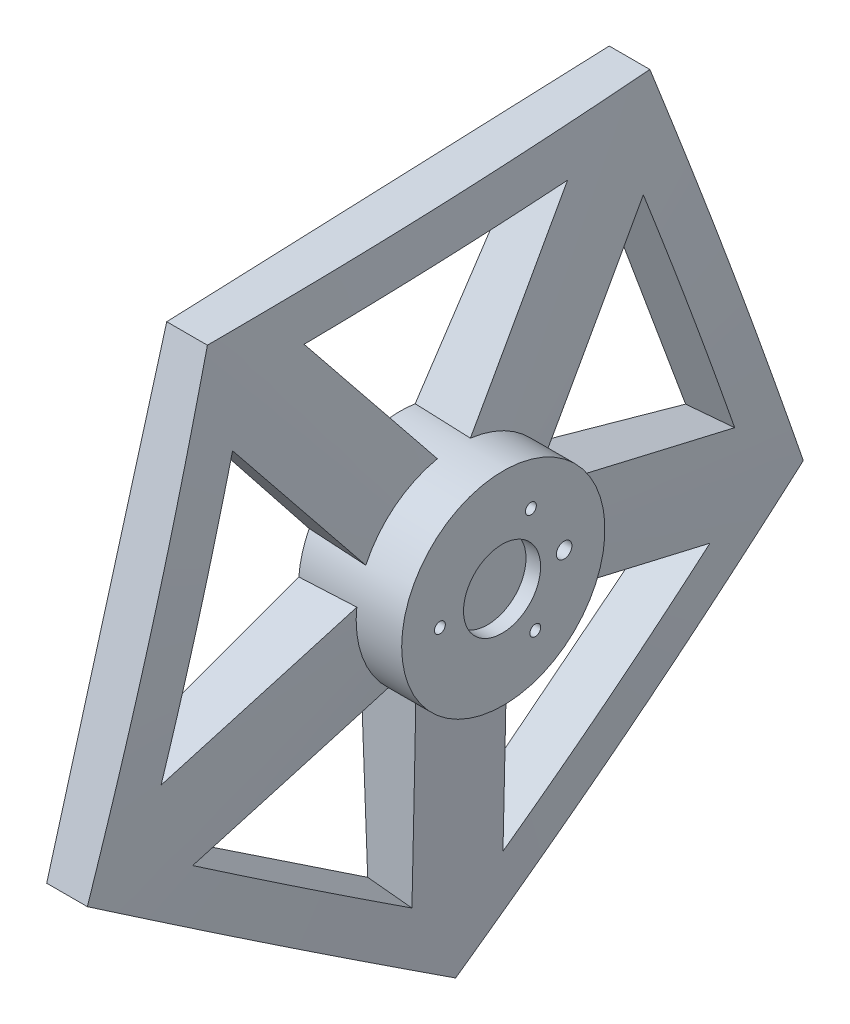
from build123d import *
from OCP.BRepAlgoAPI import BRepAlgoAPI_Cut
from OCP.TopTools import TopTools_ListOfShape
from build123d.topology import SkipClean

# Parameters (mm, degrees)
EXTRUDE_1_DEPTH             = 24
CUT_EXTRUDE_1_DEPTH         = 30
PATTERN_CIRCULAR_1_COUNT    = 5
CUT_EXTRUDE_2_DEPTH         = 84
PATTERN_CIRCULAR_2_COUNT    = 5
SKETCH_3_R                  = 33.35
EXTRUDE_2_DEPTH             = 60
CUT_EXTRUDE_START           = 0.102
CUT_EXTRUDE_4_OUTLINE_R     = 33.35
CUT_EXTRUDE_4_OUTLINE_R_2   = 9.18
CUT_EXTRUDE_4_DEPTH         = 5.799227236
CUT_EXTRUDE_START_2         = -12.5
CUT_EXTRUDE_4_2_OUTLINE_R   = 1.683
CUT_EXTRUDE_4_2_OUTLINE_R_2 = 2.448
CUT_EXTRUDE_4_2_DEPTH       = 12.738427236
CUT_EXTRUDE_START_3         = -1.428
CUT_EXTRUDE_4_3_OUTLINE_R   = 10.914
CUT_EXTRUDE_4_3_OUTLINE_R_2 = 9.18
CUT_EXTRUDE_4_3_DEPTH       = 1.666427236
CUT_EXTRUDE_4_4_OUTLINE_R   = 11.22
CUT_EXTRUDE_4_4_OUTLINE_R_2 = 10.914
CUT_EXTRUDE_4_4_DEPTH       = 1.122
CUT_EXTRUDE_4_5_OUTLINE_R   = 11.22
CUT_EXTRUDE_4_5_OUTLINE_R_2 = 10.914
CUT_EXTRUDE_4_5_DEPTH       = 0.238427236
SKETCH_11_R                 = 12.642
SKETCH_11_R_2               = 1.783
SKETCH_11_R_3               = 2.548
CUT_EXTRUDE_7_DEPTH         = 25
CUT_EXTRUDE_8_DEPTH         = 182.687484155
CUT_EXTRUDE_8_DEPTH_BACK    = 182.687484155
SKETCH_12_W                 = 55.167462985
SKETCH_12_H                 = 93.873666854
CUT_EXTRUDE_9_DEPTH         = 175.808256688
CUT_EXTRUDE_9_DEPTH_BACK    = 175.808256688
SKETCH_13_R                 = 1.783
SKETCH_13_R_2               = 2.548
SKETCH_14_R                 = 4.783
SKETCH_14_R_2               = 5.548
CUT_EXTRUDE_10_DEPTH        = 15


with BuildPart() as part:
    # 草图1 → 凸台-拉伸1 (new body)
    with BuildSketch(Plane(origin=(0, 0, 0), x_dir=(0, 0, -1), z_dir=(1, 0, 0))):
        Polygon((118.97758907, -33.510800483), (68.636762138, 102.799004534), (-76.557737191, 97.044079295), (-115.952045824, -42.822465123), (4.895431807, -123.509818223), align=None)
    extrude(amount=EXTRUDE_1_DEPTH)

    # 草图2 → 切除-拉伸1 (cut)
    with BuildSketch(Plane(origin=(21.885665564, 0.414902387, 1.473079874), x_dir=(0, 0.9625489150768215, -0.2711080708581613), z_dir=(-0.9975640502598243, -0.018911543026637837, -0.06714401812199275))):
        Polygon((-72.654252801, -98.71005792), (72.654252801, -98.71005792), (368.193435696, -98.71005792), (343.034484831, 55.492595796), (-381.628768987, 22.909231101), (-450.567959047, -98.71005792), align=None)
    cut_extrude_1 = extrude(amount=-CUT_EXTRUDE_1_DEPTH, mode=Mode.SUBTRACT)

    # 阵列(圆周)1: 切除-拉伸1 ×5 about axis
    pattern_circular_1_axis = Axis((0, 0, 0), (1, 0, 0))
    for i in range(1, PATTERN_CIRCULAR_1_COUNT):
        add(cut_extrude_1.rotate(pattern_circular_1_axis, i * 360 / PATTERN_CIRCULAR_1_COUNT), mode=Mode.SUBTRACT)

    # 草图4 → 切除-拉伸2 (cut)
    with BuildSketch(Plane(origin=(21.885665564, 0.530191543, -1.435620156), x_dir=(-0.06540654102068788, -0.0020321134284714422, -0.9978566304368194), z_dir=(0.9975640502598243, 0.024166503933362515, -0.06543657782046403))):
        Polygon((93.526415419, -11.461750602), (63.453576352, 69.657775992), (22.527950254, 8.351619529), align=None)
    cut_extrude_2 = extrude(amount=-CUT_EXTRUDE_2_DEPTH, mode=Mode.SUBTRACT)

    # 阵列(圆周)2: 切除-拉伸2 ×5 about axis
    pattern_circular_2_axis = Axis((0, 0, 0), (1, 0, 0))
    for i in range(1, PATTERN_CIRCULAR_2_COUNT):
        add(cut_extrude_2.rotate(pattern_circular_2_axis, i * 360 / PATTERN_CIRCULAR_2_COUNT), mode=Mode.SUBTRACT)

    # 草图3 → 凸台-拉伸2 (add)
    with BuildSketch(Plane.ZY):
        Circle(SKETCH_3_R)
    extrude(amount=-EXTRUDE_2_DEPTH)


with BuildPart() as cut_extrude_4_tool:
    # 切除-拉伸4: read off the stored shape, not the designer's step
    # 切除-拉伸4 outline → 切除-拉伸4 (new body)
    with BuildSketch(Plane(origin=(54.098772764, 0, 0), x_dir=(0, 0, -1), z_dir=(1, 0, 0)).offset(CUT_EXTRUDE_START)):
        Circle(CUT_EXTRUDE_4_OUTLINE_R)
        with Locations((-0.4144, 0.002184363)):
            Circle(CUT_EXTRUDE_4_OUTLINE_R_2, mode=Mode.SUBTRACT)
    extrude(amount=CUT_EXTRUDE_4_DEPTH)


with BuildPart() as part_1:
    add(part.part)

    # 切除-拉伸4: cut by cut_extrude_4_tool, with a tolerance
    cut_extrude_4_stock = TopTools_ListOfShape()
    cut_extrude_4_stock.Append(part_1.part.wrapped)
    cut_extrude_4_tools = TopTools_ListOfShape()
    cut_extrude_4_tools.Append(cut_extrude_4_tool.part.wrapped)
    cut_extrude_4_cut = BRepAlgoAPI_Cut()
    cut_extrude_4_cut.SetArguments(cut_extrude_4_stock)
    cut_extrude_4_cut.SetTools(cut_extrude_4_tools)
    cut_extrude_4_cut.SetFuzzyValue(0.00001)
    cut_extrude_4_cut.Build()
    add(Compound.cast(cut_extrude_4_cut.Shape()).solids(), mode=Mode.REPLACE)


with BuildPart() as cut_extrude_4_2_tool:
    # Cut-Extrude 4 2 outline → Cut-Extrude 4 2 (new body)
    with BuildSketch(Plane(origin=(54.098772764, 0, 0), x_dir=(0, 0, -1), z_dir=(1, 0, 0)).offset(CUT_EXTRUDE_START_2)):
        with Locations((-20.797458989, -0.829023312)):
            Circle(CUT_EXTRUDE_4_2_OUTLINE_R)
        with Locations((9.057282532, 18.070035094)):
            Circle(CUT_EXTRUDE_4_2_OUTLINE_R)
        with Locations((19.96865899, 0.83339204)):
            Circle(CUT_EXTRUDE_4_2_OUTLINE_R_2)
        with Locations((10.496976459, -17.234458691)):
            Circle(CUT_EXTRUDE_4_2_OUTLINE_R)
    extrude(amount=CUT_EXTRUDE_4_2_DEPTH)


with BuildPart() as part_2:
    add(part_1.part)

    # Cut-Extrude 4 2: cut by cut_extrude_4_2_tool, with a tolerance
    cut_extrude_4_2_stock = TopTools_ListOfShape()
    cut_extrude_4_2_stock.Append(part_2.part.wrapped)
    cut_extrude_4_2_tools = TopTools_ListOfShape()
    cut_extrude_4_2_tools.Append(cut_extrude_4_2_tool.part.wrapped)
    cut_extrude_4_2_cut = BRepAlgoAPI_Cut()
    cut_extrude_4_2_cut.SetArguments(cut_extrude_4_2_stock)
    cut_extrude_4_2_cut.SetTools(cut_extrude_4_2_tools)
    cut_extrude_4_2_cut.SetFuzzyValue(0.00001)
    cut_extrude_4_2_cut.Build()
    add(Compound.cast(cut_extrude_4_2_cut.Shape()).solids(), mode=Mode.REPLACE)


with BuildPart() as cut_extrude_4_3_tool:
    # Cut-Extrude 4 3 outline → Cut-Extrude 4 3 (new body)
    with BuildSketch(Plane(origin=(54.098772764, 0, 0), x_dir=(0, 0, -1), z_dir=(1, 0, 0)).offset(CUT_EXTRUDE_START_3)):
        with Locations((-0.4144, 0.002184363)):
            Circle(CUT_EXTRUDE_4_3_OUTLINE_R)
        with Locations((-0.4144, 0.002184363)):
            Circle(CUT_EXTRUDE_4_3_OUTLINE_R_2, mode=Mode.SUBTRACT)
    extrude(amount=CUT_EXTRUDE_4_3_DEPTH)


with BuildPart() as part_3:
    add(part_2.part)

    # Cut-Extrude 4 3: cut by cut_extrude_4_3_tool, with a tolerance
    cut_extrude_4_3_stock = TopTools_ListOfShape()
    cut_extrude_4_3_stock.Append(part_3.part.wrapped)
    cut_extrude_4_3_tools = TopTools_ListOfShape()
    cut_extrude_4_3_tools.Append(cut_extrude_4_3_tool.part.wrapped)
    cut_extrude_4_3_cut = BRepAlgoAPI_Cut()
    cut_extrude_4_3_cut.SetArguments(cut_extrude_4_3_stock)
    cut_extrude_4_3_cut.SetTools(cut_extrude_4_3_tools)
    cut_extrude_4_3_cut.SetFuzzyValue(0.00001)
    cut_extrude_4_3_cut.Build()
    add(Compound.cast(cut_extrude_4_3_cut.Shape()).solids(), mode=Mode.REPLACE)


with BuildPart() as cut_extrude_4_4_tool:
    # Cut-Extrude 4 4 outline → Cut-Extrude 4 4 (new body)
    with BuildSketch(Plane(origin=(54.098772764, 0, 0), x_dir=(0, 0, -1), z_dir=(1, 0, 0)).offset(CUT_EXTRUDE_START_3)):
        with Locations((-0.4144, 0.002184363)):
            Circle(CUT_EXTRUDE_4_4_OUTLINE_R)
        with Locations((-0.4144, 0.002184363)):
            Circle(CUT_EXTRUDE_4_4_OUTLINE_R_2, mode=Mode.SUBTRACT)
    extrude(amount=CUT_EXTRUDE_4_4_DEPTH)


with BuildPart() as part_4:
    add(part_3.part)

    # Cut-Extrude 4 4: cut by cut_extrude_4_4_tool, with a tolerance
    cut_extrude_4_4_stock = TopTools_ListOfShape()
    cut_extrude_4_4_stock.Append(part_4.part.wrapped)
    cut_extrude_4_4_tools = TopTools_ListOfShape()
    cut_extrude_4_4_tools.Append(cut_extrude_4_4_tool.part.wrapped)
    cut_extrude_4_4_cut = BRepAlgoAPI_Cut()
    cut_extrude_4_4_cut.SetArguments(cut_extrude_4_4_stock)
    cut_extrude_4_4_cut.SetTools(cut_extrude_4_4_tools)
    cut_extrude_4_4_cut.SetFuzzyValue(0.00001)
    cut_extrude_4_4_cut.Build()
    add(Compound.cast(cut_extrude_4_4_cut.Shape()).solids(), mode=Mode.REPLACE)


with BuildPart() as cut_extrude_4_5_tool:
    # Cut-Extrude 4 5 outline → Cut-Extrude 4 5 (new body)
    with BuildSketch(Plane(origin=(54.098772764, 0, 0), x_dir=(0, 0, -1), z_dir=(1, 0, 0))):
        with Locations((-0.4144, 0.002184363)):
            Circle(CUT_EXTRUDE_4_5_OUTLINE_R)
        with Locations((-0.4144, 0.002184363)):
            Circle(CUT_EXTRUDE_4_5_OUTLINE_R_2, mode=Mode.SUBTRACT)
    extrude(amount=CUT_EXTRUDE_4_5_DEPTH)


with BuildPart() as part_5:
    add(part_4.part)

    # Cut-Extrude 4 5: cut by cut_extrude_4_5_tool, with a tolerance
    cut_extrude_4_5_stock = TopTools_ListOfShape()
    cut_extrude_4_5_stock.Append(part_5.part.wrapped)
    cut_extrude_4_5_tools = TopTools_ListOfShape()
    cut_extrude_4_5_tools.Append(cut_extrude_4_5_tool.part.wrapped)
    cut_extrude_4_5_cut = BRepAlgoAPI_Cut()
    cut_extrude_4_5_cut.SetArguments(cut_extrude_4_5_stock)
    cut_extrude_4_5_cut.SetTools(cut_extrude_4_5_tools)
    cut_extrude_4_5_cut.SetFuzzyValue(0.00001)
    cut_extrude_4_5_cut.Build()
    add(Compound.cast(cut_extrude_4_5_cut.Shape()).solids(), mode=Mode.REPLACE)


with BuildPart() as cut_extrude_4_6_tool:
    # Cut-Extrude 4 6 outline → Cut-Extrude 4 6 (revolve)
    with BuildSketch(Plane(origin=(0, 0.002184363, 0.4144), x_dir=(0, 1, 0), z_dir=(0, 0, -1))):
        Polygon((33.764400071, 54.200772764), (12.24, 54.200772764), (12.342, 54.098772764), (33.764400071, 54.098772764), align=None)
        Polygon((12.138, 54.098772764), (12.24, 54.200772764), (11.22, 54.200772764), (11.22, 54.098772764), align=None)
        Polygon((11.118, 52.568772764), (11.22, 52.670772764), (9.18, 52.670772764), (9.282, 52.568772764), align=None)
    revolve(axis=Axis((0, 0.002184363, 0.4144), (1, 0, 0)))


with BuildPart() as part_6:
    add(part_5.part)

    # Cut-Extrude 4 6: cut by cut_extrude_4_6_tool, with a tolerance
    cut_extrude_4_6_stock = TopTools_ListOfShape()
    cut_extrude_4_6_stock.Append(part_6.part.wrapped)
    cut_extrude_4_6_tools = TopTools_ListOfShape()
    cut_extrude_4_6_tools.Append(cut_extrude_4_6_tool.part.wrapped)
    cut_extrude_4_6_cut = BRepAlgoAPI_Cut()
    cut_extrude_4_6_cut.SetArguments(cut_extrude_4_6_stock)
    cut_extrude_4_6_cut.SetTools(cut_extrude_4_6_tools)
    cut_extrude_4_6_cut.SetFuzzyValue(0.00001)
    cut_extrude_4_6_cut.Build()
    add(Compound.cast(cut_extrude_4_6_cut.Shape()).solids(), mode=Mode.REPLACE)


with BuildPart() as cut_extrude_4_7_tool:
    # Cut-Extrude 4 7 outline → Cut-Extrude 4 7 (revolve)
    with BuildSketch(Plane.YX):
        Polygon((123.60679775, 13.34204565), (123.60679775, 20.106005687), (33.349999999, 20.106005687), (33.349999999, 18.961940411), align=None)
    revolve(axis=Axis((0, 0, 0), (1, 0, 0)))


with BuildPart() as part_7:
    add(part_6.part)

    # Cut-Extrude 4 7: cut by cut_extrude_4_7_tool, with a tolerance
    cut_extrude_4_7_stock = TopTools_ListOfShape()
    cut_extrude_4_7_stock.Append(part_7.part.wrapped)
    cut_extrude_4_7_tools = TopTools_ListOfShape()
    cut_extrude_4_7_tools.Append(cut_extrude_4_7_tool.part.wrapped)
    cut_extrude_4_7_cut = BRepAlgoAPI_Cut()
    cut_extrude_4_7_cut.SetArguments(cut_extrude_4_7_stock)
    cut_extrude_4_7_cut.SetTools(cut_extrude_4_7_tools)
    cut_extrude_4_7_cut.SetFuzzyValue(0.00001)
    cut_extrude_4_7_cut.Build()
    add(Compound.cast(cut_extrude_4_7_cut.Shape()).solids(), mode=Mode.REPLACE)

    # 草图11 → 切除-拉伸7 (cut)
    with SkipClean():  # the faces are left unmerged after this step: merging them gives an invalid solid
        with BuildSketch(Plane(origin=(54.098772764, 0, 0), x_dir=(0, 0, -1), z_dir=(1, 0, 0))):
            with Locations((-0.4144, 0.002184363)):
                Circle(SKETCH_11_R)
            with Locations((-20.797458989, -0.829023312)):
                Circle(SKETCH_11_R_2)
            with Locations((9.057282532, 18.070035094)):
                Circle(SKETCH_11_R_2)
            with Locations((19.96865899, 0.83339204)):
                Circle(SKETCH_11_R_3)
            with Locations((10.496976459, -17.234458691)):
                Circle(SKETCH_11_R_2)
        extrude(amount=-CUT_EXTRUDE_7_DEPTH, mode=Mode.SUBTRACT)


with BuildPart() as cut_extrude_7_piece_1:
    # of the separate pieces the step leaves, piece 1, a body of its own (cut_extrude_7_pieces)
    add(part_7.part.solids().sort_by_distance((0, -33.510800483, -118.97758907))[0])


with BuildPart() as cut_extrude_7_piece_2:
    # of the separate pieces the step leaves, piece 2, a body of its own (cut_extrude_7_pieces)
    add(part_7.part.solids().sort_by_distance((60, 0.002184363, -8.7656))[0])


with BuildPart() as cut_extrude_7_piece_3:
    # of the separate pieces the step leaves, piece 3, a body of its own (cut_extrude_7_pieces)
    add(part_7.part.solids().sort_by_distance((54.200772764, 12.242184363, 0.4144))[0])


with BuildPart() as cut_extrude_8_tool:
    # 草图12 → 切除-拉伸8 (new, two sides: drawn at the far end of the back side and taken through both)
    with SkipClean():  # the faces are left unmerged after this step: merging them gives an invalid solid
        with BuildSketch(Plane.XY.offset(-CUT_EXTRUDE_8_DEPTH_BACK)):
            with Locations((61.45975115, -1.791464419)):
                Rectangle(SKETCH_12_W, SKETCH_12_H)
        extrude(amount=CUT_EXTRUDE_8_DEPTH + CUT_EXTRUDE_8_DEPTH_BACK)


with BuildPart() as cut_extrude_7_piece_1_1:
    with SkipClean():  # the faces are left unmerged after this step: merging them gives an invalid solid
        add(cut_extrude_7_piece_1.part)

        # 切除-拉伸8: cut by cut_extrude_8_tool
        add(cut_extrude_8_tool.part, mode=Mode.SUBTRACT)

    # 草图13 → 切除-拉伸9 (cut, two sides: drawn at the far end of the back side and taken through both)
    with SkipClean():  # the faces are left unmerged after this step: merging them gives an invalid solid
        with BuildSketch(Plane(origin=(33.876019657, 0, 0), x_dir=(0, 0, -1), z_dir=(1, 0, 0)).offset(-CUT_EXTRUDE_9_DEPTH_BACK)):
            with Locations((10.496976459, -17.234458691)):
                Circle(SKETCH_13_R)
            with Locations((19.96865899, 0.83339204)):
                Circle(SKETCH_13_R_2)
            with Locations((9.057282532, 18.070035094)):
                Circle(SKETCH_13_R)
            with Locations((-20.797458989, -0.829023312)):
                Circle(SKETCH_13_R)
        extrude(amount=CUT_EXTRUDE_9_DEPTH + CUT_EXTRUDE_9_DEPTH_BACK, mode=Mode.SUBTRACT)

    # 草图14 → 切除-拉伸10 (cut)
    with SkipClean():  # the faces are left unmerged after this step: merging them gives an invalid solid
        with BuildSketch(Plane.ZY):
            with Locations((-9.057282532, 18.070035094)):
                Circle(SKETCH_14_R)
            with Locations((-19.96865899, 0.83339204)):
                Circle(SKETCH_14_R_2)
            with Locations((-10.496976459, -17.234458691)):
                Circle(SKETCH_14_R)
            with Locations((20.797458989, -0.829023312)):
                Circle(SKETCH_14_R)
        extrude(amount=-CUT_EXTRUDE_10_DEPTH, mode=Mode.SUBTRACT)


with BuildPart() as cut_extrude_7_piece_2_1:
    with SkipClean():  # the faces are left unmerged after this step: merging them gives an invalid solid
        add(cut_extrude_7_piece_2.part)

        # 切除-拉伸8: cut by cut_extrude_8_tool
        add(cut_extrude_8_tool.part, mode=Mode.SUBTRACT)


with BuildPart() as cut_extrude_7_piece_3_1:
    with SkipClean():  # the faces are left unmerged after this step: merging them gives an invalid solid
        add(cut_extrude_7_piece_3.part)

        # 切除-拉伸8: cut by cut_extrude_8_tool
        add(cut_extrude_8_tool.part, mode=Mode.SUBTRACT)


solid = cut_extrude_7_piece_1_1.part
